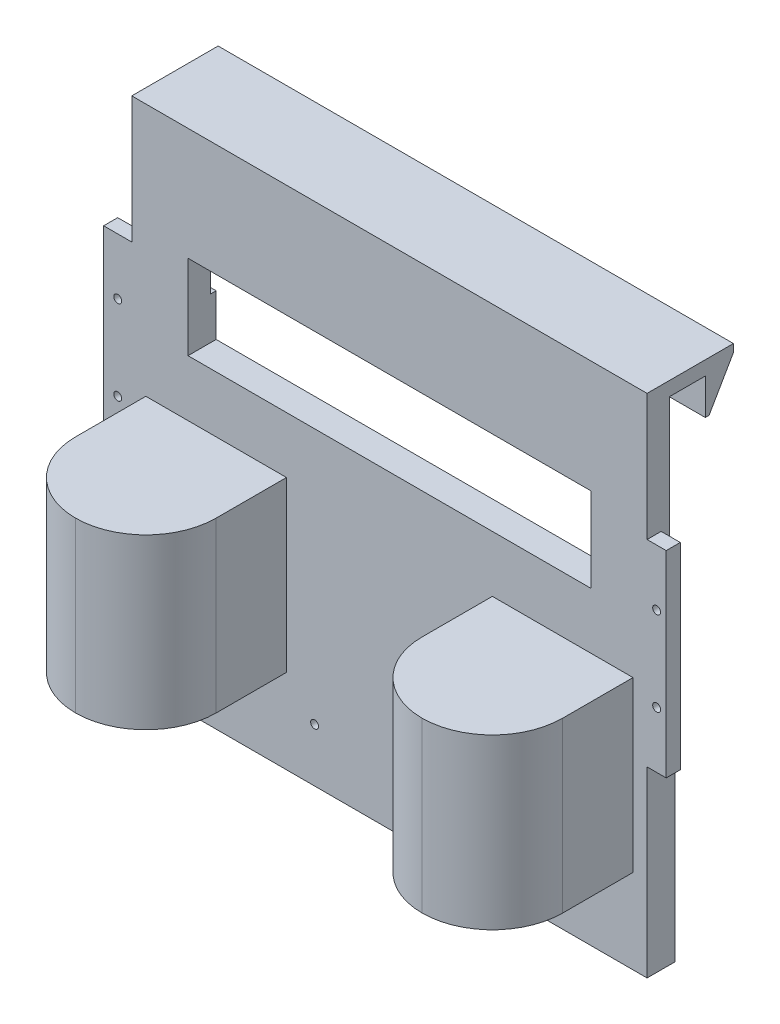
from build123d import *

# Parameters (mm, degrees)
CROQUIS1_W                 = 180
CROQUIS1_H                 = 180
SALIENTE_EXTRUIR1_DEPTH    = 30.7
CROQUIS2_W                 = 180
CROQUIS2_H                 = 162.21
CORTAR_EXTRUIR1_DEPTH      = 20.7
CROQUIS3_W                 = 10.7
CROQUIS3_H                 = 12.79
CORTAR_EXTRUIR2_DEPTH      = 274.7
SALIENTE_EXTRUIR2_DEPTH    = 20
CORTAR_EXTRUIR3_DEPTH      = 147
CORTAR_EXTRUIR3_DEPTH_BACK = 147
CROQUIS5_W                 = 10
CROQUIS5_H                 = 45
CROQUIS5_W_2               = 6.8
CROQUIS6_W                 = 93.2
CROQUIS6_H                 = 38
CROQUIS6_W_2               = 6.8
CROQUIS6_H_2               = 70
CROQUIS6_W_3               = 10
CORTAR_EXTRUIR4_DEPTH      = 5
CROQUIS7_W                 = 183.2
CROQUIS7_H                 = 50
CORTAR_EXTRUIR5_DEPTH      = 2
CROQUIS8_W                 = 45
CROQUIS8_H                 = 10
SALIENTE_EXTRUIR3_DEPTH    = 38
CROQUIS9_R                 = 1.4
CROQUIS9_W                 = 143.2
CROQUIS9_H                 = 30
CORTAR_EXTRUIR6_DEPTH      = 20
CHAFL_N1_SIZE              = 15
CHAFL_N1_SIZE2             = 8.660254038
CROQUIS10_W                = 50
CROQUIS10_H                = 60
SALIENTE_EXTRUIR4_DEPTH    = 50
REDONDEO1_R                = 25
CROQUIS11_R                = 10.8
CORTAR_EXTRUIR7_DEPTH      = 40


with BuildPart() as part:
    # Croquis1 → Saliente-Extruir1 (new body)
    with BuildSketch(Plane.XY):
        with Locations((90, 90)):
            Rectangle(CROQUIS1_W, CROQUIS1_H)
    extrude(amount=SALIENTE_EXTRUIR1_DEPTH)

    # Croquis2 → Cortar-Extruir1 (cut)
    with BuildSketch(Plane(origin=(0, 0, 0), x_dir=(-1, 0, 0), z_dir=(0, 0, -1))):
        with Locations((-90, 81.105)):
            Rectangle(CROQUIS2_W, CROQUIS2_H)
    extrude(amount=-CORTAR_EXTRUIR1_DEPTH, mode=Mode.SUBTRACT)

    # Croquis3 → Cortar-Extruir2 (cut)
    with BuildSketch(Plane.ZY):
        with Locations((15.35, 168.605)):
            Rectangle(CROQUIS3_W, CROQUIS3_H)
    extrude(amount=-CORTAR_EXTRUIR2_DEPTH, mode=Mode.SUBTRACT)

    # Croquis4 → Saliente-Extruir2 (add)
    with BuildSketch(Plane(origin=(180, 0, 0), x_dir=(0, 0, -1), z_dir=(1, 0, 0))):
        Polygon((-20.7, 0), (-20.7, 175), (-10, 175), (-10, 162.21), (0, 162.21), (0, 180), (-30.7, 180), (-30.7, 0), align=None)
    extrude(amount=SALIENTE_EXTRUIR2_DEPTH)

    # Croquis5 → Cortar-Extruir3 (cut, two sides: drawn at the far end of the back side and taken through both)
    with BuildSketch(Plane(origin=(0, 0, 20.7), x_dir=(-1, 0, 0), z_dir=(0, 0, -1)).offset(-CORTAR_EXTRUIR3_DEPTH_BACK)):
        Polygon((-55, 38), (-10, 38), (-10, 65), (0, 65), (0, 38), (0, 0), (-55, 0), align=None)
        Polygon((-148.2, 38), (-193.2, 38), (-193.2, 65), (-200, 65), (-200, 38), (-200, 0), (-148.2, 0), align=None)
        with Locations((-5, 157.5)):
            Rectangle(CROQUIS5_W, CROQUIS5_H)
        with Locations((-196.6, 157.5)):
            Rectangle(CROQUIS5_W_2, CROQUIS5_H)
    extrude(amount=CORTAR_EXTRUIR3_DEPTH + CORTAR_EXTRUIR3_DEPTH_BACK, mode=Mode.SUBTRACT)

    # Croquis6 → Cortar-Extruir4 (cut)
    with BuildSketch(Plane(origin=(0, 0, 20.7), x_dir=(-1, 0, 0), z_dir=(0, 0, -1))):
        with Locations((-101.6, 19)):
            Rectangle(CROQUIS6_W, CROQUIS6_H)
        with Locations((-196.6, 100)):
            Rectangle(CROQUIS6_W_2, CROQUIS6_H_2)
        with Locations((-5, 100)):
            Rectangle(CROQUIS6_W_3, CROQUIS6_H_2)
    extrude(amount=-CORTAR_EXTRUIR4_DEPTH, mode=Mode.SUBTRACT)

    # Croquis7 → Cortar-Extruir5 (cut)
    with BuildSketch(Plane(origin=(0, 0, 20.7), x_dir=(-1, 0, 0), z_dir=(0, 0, -1))):
        with Locations((-101.6, 150)):
            Rectangle(CROQUIS7_W, CROQUIS7_H)
    extrude(amount=-CORTAR_EXTRUIR5_DEPTH, mode=Mode.SUBTRACT)

    # Croquis8 → Saliente-Extruir3 (add)
    with BuildSketch(Plane.XZ.offset(-38)):
        with Locations((32.5, 25.7)):
            Rectangle(CROQUIS8_W, CROQUIS8_H)
        with Locations((170.7, 25.7)):
            Rectangle(CROQUIS8_W, CROQUIS8_H)
    extrude(amount=SALIENTE_EXTRUIR3_DEPTH)

    # Croquis9 → Cortar-Extruir6 (cut)
    with BuildSketch(Plane.XY.offset(30.7)):
        with Locations((5, 115)):
            Circle(CROQUIS9_R)
        with Locations((5, 85)):
            Circle(CROQUIS9_R)
        with Locations((196.6, 115)):
            Circle(CROQUIS9_R)
        with Locations((196.6, 85)):
            Circle(CROQUIS9_R)
        with Locations((128.2, 19)):
            Circle(CROQUIS9_R)
        with Locations((75, 19)):
            Circle(CROQUIS9_R)
        with Locations((101.6, 125)):
            Rectangle(CROQUIS9_W, CROQUIS9_H)
    extrude(amount=-CORTAR_EXTRUIR6_DEPTH, mode=Mode.SUBTRACT)

    # Chaflán1
    chafl_n1_edges = [part.edges().sort_by_distance(p)[0] for p in [
        (101.6, 162.21, 0),
    ]]
    chafl_n1_side = [part.faces().sort_by_distance(p)[0] for p in [
        (101.6, 171.105, 0),
    ]]
    chamfer(chafl_n1_edges, length=CHAFL_N1_SIZE, length2=CHAFL_N1_SIZE2, reference=chafl_n1_side[0])

    # Croquis10 → Saliente-Extruir4 (add)
    with BuildSketch(Plane.XY.offset(30.7)):
        with Locations((163.2, 60)):
            Rectangle(CROQUIS10_W, CROQUIS10_H)
        with Locations((40, 60)):
            Rectangle(CROQUIS10_W, CROQUIS10_H)
    extrude(amount=SALIENTE_EXTRUIR4_DEPTH)

    # Redondeo1
    redondeo1_edges = [part.edges().sort_by_distance(p)[0] for p in [
        (15, 60, 80.7),
        (65, 60, 80.7),
        (138.2, 60, 80.7),
        (188.2, 60, 80.7),
    ]]
    fillet(redondeo1_edges, radius=REDONDEO1_R - 0.0001)  # a hair under: the kernel refuses the full size

    # Croquis11 → Cortar-Extruir7 (cut)
    with BuildSketch(Plane.XZ.offset(-30)):
        with Locations(Location((163.2, 55.7, 0), (0, 0, 270))):
            Circle(CROQUIS11_R)
        with Locations(Location((40, 55.7, 0), (0, 0, 270))):
            Circle(CROQUIS11_R)
    extrude(amount=-CORTAR_EXTRUIR7_DEPTH, mode=Mode.SUBTRACT)


solid = part.part
